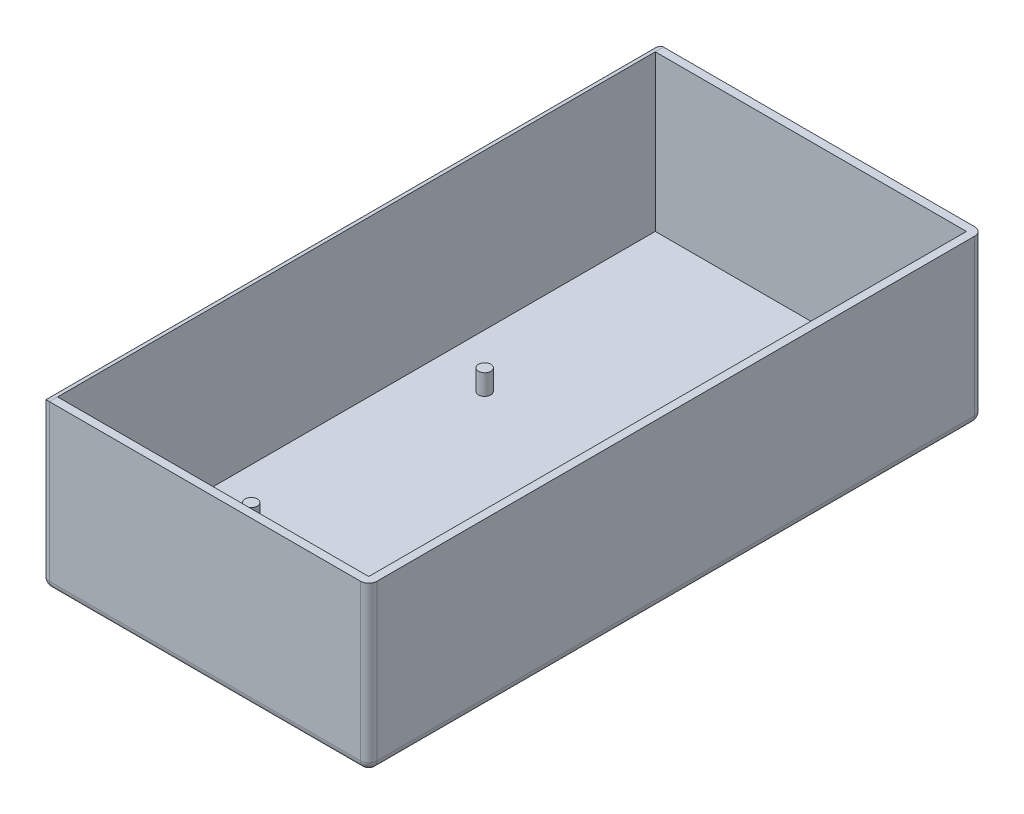
from build123d import *

# Parameters (mm, degrees)
SKETCH1_W           = 80
SKETCH1_H           = 150
BOSS_EXTRUDE1_DEPTH = 40
SKETCH2_W           = 76
SKETCH2_H           = 146
CUT_EXTRUDE1_DEPTH  = 38
SKETCH4_R           = 1.5
BOSS_EXTRUDE3_DEPTH = 5
FILLET1_R           = 2


with BuildPart() as part:
    # Sketch1 → Boss-Extrude1 (new body)
    with BuildSketch(Plane(origin=(0, 0, 0), x_dir=(1, 0, 0), z_dir=(0, 1, 0))):
        with Locations((-8.86592033, 41.755152562)):
            Rectangle(SKETCH1_W, SKETCH1_H)
    extrude(amount=BOSS_EXTRUDE1_DEPTH)

    # Sketch2 → Cut-Extrude1 (cut)
    with BuildSketch(Plane(origin=(0, 40, 0), x_dir=(1, 0, 0), z_dir=(0, 1, 0))):
        with Locations((-8.86592033, 41.755152562)):
            Rectangle(SKETCH2_W, SKETCH2_H)
    extrude(amount=-CUT_EXTRUDE1_DEPTH, mode=Mode.SUBTRACT)

    # Sketch4 → Boss-Extrude3 (add)
    with BuildSketch(Plane(origin=(0, 2, 0), x_dir=(1, 0, 0), z_dir=(0, 1, 0))):
        with Locations(Location((-33.86592033, 60.072338785, 0), (0, 0, 270))):
            Circle(SKETCH4_R)
        with Locations(Location((-33.86592033, 3.072338785, 0), (0, 0, 270))):
            Circle(SKETCH4_R)
        with Locations(Location((16.13407967, 60.072338785, 0), (0, 0, 90))):
            Circle(SKETCH4_R)
        with Locations(Location((16.13407967, 3.072338785, 0), (0, 0, 90))):
            Circle(SKETCH4_R)
    extrude(amount=BOSS_EXTRUDE3_DEPTH)

    # Fillet1
    fillet1_edges = [part.edges().sort_by_distance(p)[0] for p in [
        (-48.86592033, 40, -41.755152562),
        (-8.86592033, 0, -116.755152562),
        (31.13407967, 0, -41.755152562),
        (-8.86592033, 0, 33.244847438),
        (-48.86592033, 0, -41.755152562),
        (-48.86592033, 20, -116.755152562),
        (31.13407967, 20, -116.755152562),
        (31.13407967, 20, 33.244847438),
        (-48.86592033, 20, 33.244847438),
    ]]
    fillet(fillet1_edges, radius=FILLET1_R - 0.0001)  # a hair under: the kernel refuses the full size


solid = part.part
